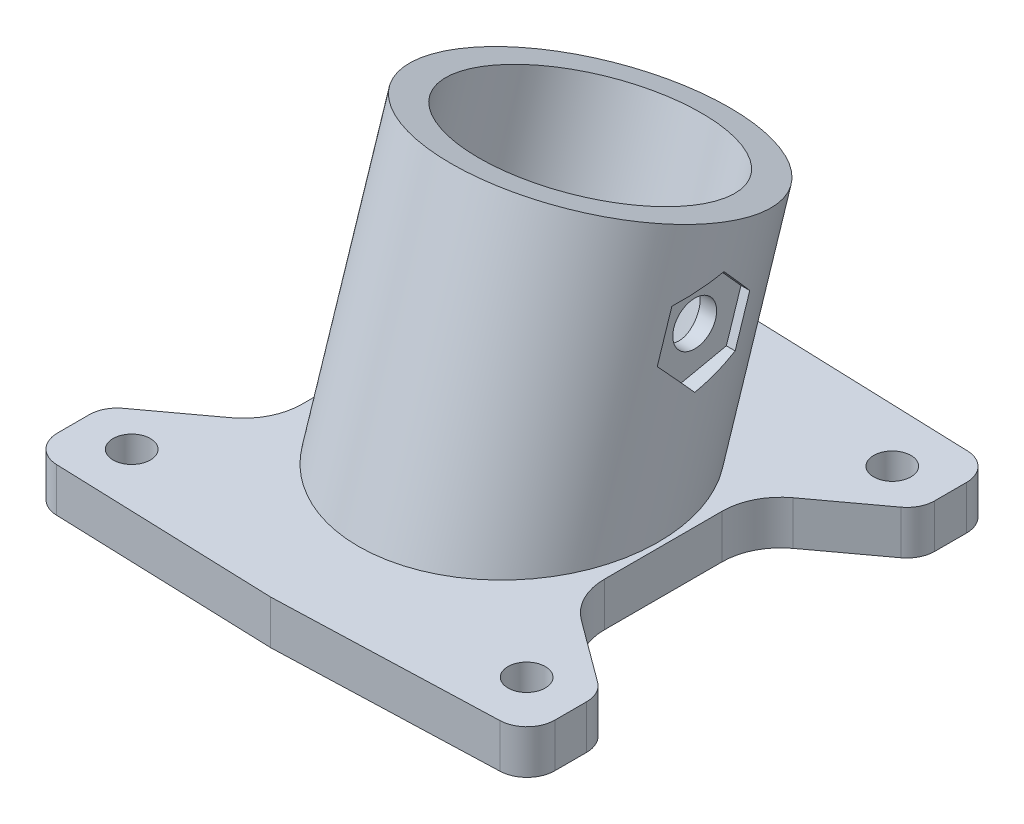
from build123d import *

# Parameters (mm, degrees)
SKETCH_1_R               = 1.275
EXTRUDE_1_DEPTH          = 3
SKETCH_1_3_R             = 1.275
CUT_EXTRUDE_2_DEPTH      = 33.670000656
CUT_EXTRUDE_3_REACH      = 42.042
SKETCH_3_R               = 8
CUT_EXTRUDE_4_DEPTH      = 33.670000656
CUT_EXTRUDE_4_DEPTH_BACK = 33.670000656
SKETCH_4_R               = 1.5
CUT_EXTRUDE_START        = 10
SKETCH_4_3_R             = 1.5
CUT_EXTRUDE_6_DEPTH      = 1
CUT_EXTRUDE_START_2      = -10
SKETCH_5_R               = 3
CUT_EXTRUDE_8_DEPTH      = 1


with BuildPart() as part:
    # 草圖1 → 填料-伸長1 (new body)
    with BuildSketch(Plane(origin=(0, 0, 0), x_dir=(1, 0, 0), z_dir=(0, 1, 0))):
        with BuildLine():
            Line((15.165815849, 15.974341877), (0, 16.5))
            Line((0, 16.5), (-15.165815849, 15.974341877))
            ThreePointArc((-15.165815849, 15.974341877), (-16.466574204, 15.395510535), (-17, 14.075482147))
            Line((-17, 14.075482147), (-17, 11.902263032))
            ThreePointArc((-17, 11.902263032), (-16.795938816, 11.045646706), (-16.227587862, 10.373032633))
            Line((-16.227587862, 10.373032633), (-11.976130816, 7.238193459))
            ThreePointArc((-11.976130816, 7.238193459), (-10.779602492, 5.822163833), (-10.35, 4.01876104))
            Line((-10.35, 4.01876104), (-10.35, -4.01876104))
            ThreePointArc((-10.35, -4.01876104), (-10.779602492, -5.822163833), (-11.976130816, -7.238193459))
            Line((-11.976130816, -7.238193459), (-16.227587862, -10.373032633))
            ThreePointArc((-16.227587862, -10.373032633), (-16.795938816, -11.045646706), (-17, -11.902263032))
            Line((-17, -11.902263032), (-17, -14.075482147))
            ThreePointArc((-17, -14.075482147), (-16.466574204, -15.395510535), (-15.165815849, -15.974341877))
            Line((-15.165815849, -15.974341877), (0, -16.5))
            Line((0, -16.5), (15.165815849, -15.974341877))
            ThreePointArc((15.165815849, -15.974341877), (16.466574204, -15.395510535), (17, -14.075482147))
            Line((17, -14.075482147), (17, -11.902263032))
            ThreePointArc((17, -11.902263032), (16.795938816, -11.045646706), (16.227587862, -10.373032633))
            Line((16.227587862, -10.373032633), (11.976130816, -7.238193459))
            ThreePointArc((11.976130816, -7.238193459), (10.779602492, -5.822163833), (10.35, -4.01876104))
            Line((10.35, -4.01876104), (10.35, 4.01876104))
            ThreePointArc((10.35, 4.01876104), (10.779602492, 5.822163833), (11.976130816, 7.238193459))
            Line((11.976130816, 7.238193459), (16.227587862, 10.373032633))
            ThreePointArc((16.227587862, 10.373032633), (16.795938816, 11.045646706), (17, 11.902263032))
            Line((17, 11.902263032), (17, 14.075482147))
            ThreePointArc((17, 14.075482147), (16.466574204, 15.395510535), (15.165815849, 15.974341877))
        make_face()
        with Locations((-13.5, -12.5)):
            Circle(SKETCH_1_R, mode=Mode.SUBTRACT)
        with Locations((13.5, -12.5)):
            Circle(SKETCH_1_R, mode=Mode.SUBTRACT)
        with Locations((-13.5, 12.5)):
            Circle(SKETCH_1_R, mode=Mode.SUBTRACT)
        with Locations((13.5, 12.5)):
            Circle(SKETCH_1_R, mode=Mode.SUBTRACT)
    extrude(amount=EXTRUDE_1_DEPTH)

    # 草圖2 one side → 旋轉1 (revolve)
    with BuildSketch(Plane(origin=(0, 0, 0), x_dir=(0, 0, -1), z_dir=(1, 0, 0))):
        Polygon((5.34660517, 19.405337686), (-4.163735517, 22.496198409), (-10.5, 3), (0.014870422, 3), align=None)
    revolve(axis=Axis((0, 6.088115951, -1.018508107), (0, 0.9510340687309482, -0.3090860723375583)))

    # 草圖1<3> → 除料-伸長2 (cut, through all)
    with BuildSketch(Plane(origin=(0, 0, 0), x_dir=(1, 0, 0), z_dir=(0, 1, 0))):
        with BuildLine():
            Line((15.165815849, 15.974341877), (0, 16.5))
            Line((0, 16.5), (-15.165815849, 15.974341877))
            ThreePointArc((-15.165815849, 15.974341877), (-16.466574204, 15.395510535), (-17, 14.075482147))
            Line((-17, 14.075482147), (-17, 11.902263032))
            ThreePointArc((-17, 11.902263032), (-16.795938816, 11.045646706), (-16.227587862, 10.373032633))
            Line((-16.227587862, 10.373032633), (-11.976130816, 7.238193459))
            ThreePointArc((-11.976130816, 7.238193459), (-10.779602492, 5.822163833), (-10.35, 4.01876104))
            Line((-10.35, 4.01876104), (-10.35, -4.01876104))
            ThreePointArc((-10.35, -4.01876104), (-10.779602492, -5.822163833), (-11.976130816, -7.238193459))
            Line((-11.976130816, -7.238193459), (-16.227587862, -10.373032633))
            ThreePointArc((-16.227587862, -10.373032633), (-16.795938816, -11.045646706), (-17, -11.902263032))
            Line((-17, -11.902263032), (-17, -14.075482147))
            ThreePointArc((-17, -14.075482147), (-16.466574204, -15.395510535), (-15.165815849, -15.974341877))
            Line((-15.165815849, -15.974341877), (0, -16.5))
            Line((0, -16.5), (15.165815849, -15.974341877))
            ThreePointArc((15.165815849, -15.974341877), (16.466574204, -15.395510535), (17, -14.075482147))
            Line((17, -14.075482147), (17, -11.902263032))
            ThreePointArc((17, -11.902263032), (16.795938816, -11.045646706), (16.227587862, -10.373032633))
            Line((16.227587862, -10.373032633), (11.976130816, -7.238193459))
            ThreePointArc((11.976130816, -7.238193459), (10.779602492, -5.822163833), (10.35, -4.01876104))
            Line((10.35, -4.01876104), (10.35, 4.01876104))
            ThreePointArc((10.35, 4.01876104), (10.779602492, 5.822163833), (11.976130816, 7.238193459))
            Line((11.976130816, 7.238193459), (16.227587862, 10.373032633))
            ThreePointArc((16.227587862, 10.373032633), (16.795938816, 11.045646706), (17, 11.902263032))
            Line((17, 11.902263032), (17, 14.075482147))
            ThreePointArc((17, 14.075482147), (16.466574204, 15.395510535), (15.165815849, 15.974341877))
        make_face()
        with Locations((-13.5, -12.5)):
            Circle(SKETCH_1_3_R, mode=Mode.SUBTRACT)
        with Locations((13.5, -12.5)):
            Circle(SKETCH_1_3_R, mode=Mode.SUBTRACT)
        with Locations((-13.5, 12.5)):
            Circle(SKETCH_1_3_R, mode=Mode.SUBTRACT)
        with Locations((13.5, 12.5)):
            Circle(SKETCH_1_3_R, mode=Mode.SUBTRACT)
    extrude(amount=-CUT_EXTRUDE_2_DEPTH, mode=Mode.SUBTRACT)

    # 除料-伸長3: up to this plane
    cut_extrude_3_end = Plane(origin=(0, 3, 0), z_dir=(0, 1, 0))
    # 草圖3 → 除料-伸長3 (cut, up to the surface)
    with BuildSketch(Plane(origin=(0, 19.123106267, -6.215009537), x_dir=(1, 0, 0), z_dir=(0, 0.9510340687309481, -0.30908607233755836)), mode=Mode.PRIVATE) as cut_extrude_3_sk1:
        with Locations((0, -0.913115939)):
            Circle(SKETCH_3_R)
    cut_extrude_3_tool1 = split(extrude(cut_extrude_3_sk1.sketch, amount=-CUT_EXTRUDE_3_REACH, mode=Mode.PRIVATE), bisect_by=cut_extrude_3_end, keep=Keep.BOTH, mode=Mode.PRIVATE)
    add(cut_extrude_3_tool1.solids().sort_by_distance((0, 19.405338, -5.346605))[0], mode=Mode.SUBTRACT)

    # 草圖4 → 除料-伸長4 (cut, two sides: drawn at the far end of the back side and taken through both)
    with BuildSketch(Plane(origin=(0, 0, 0), x_dir=(0, 0, -1), z_dir=(1, 0, 0)).offset(-CUT_EXTRUDE_4_DEPTH_BACK)):
        with Locations((3.492088736, 13.699133273)):
            Circle(SKETCH_4_R)
    extrude(amount=CUT_EXTRUDE_4_DEPTH + CUT_EXTRUDE_4_DEPTH_BACK, mode=Mode.SUBTRACT)

    # 草圖4<3> → 除料-伸長6 (cut)
    with BuildSketch(Plane(origin=(0, 0, 0), x_dir=(0, 0, -1), z_dir=(1, 0, 0)).offset(CUT_EXTRUDE_START)):
        Polygon((4.491413928, 16.773980017), (1.32885594, 16.101997647), (0.329530748, 13.027150904), (2.492763545, 10.62428653), (5.655321533, 11.296268899), (6.654646724, 14.371115642), align=None)
        with Locations((3.492088736, 13.699133273)):
            Circle(SKETCH_4_3_R, mode=Mode.SUBTRACT)
    extrude(amount=-CUT_EXTRUDE_6_DEPTH, mode=Mode.SUBTRACT)

    # 草圖5 → 除料-伸長8 (cut)
    with BuildSketch(Plane(origin=(0, 0, 0), x_dir=(0, 0, -1), z_dir=(1, 0, 0)).offset(CUT_EXTRUDE_START_2)):
        with Locations((3.492088736, 13.699133273)):
            Circle(SKETCH_5_R)
    extrude(amount=CUT_EXTRUDE_8_DEPTH, mode=Mode.SUBTRACT)


solid = part.part
